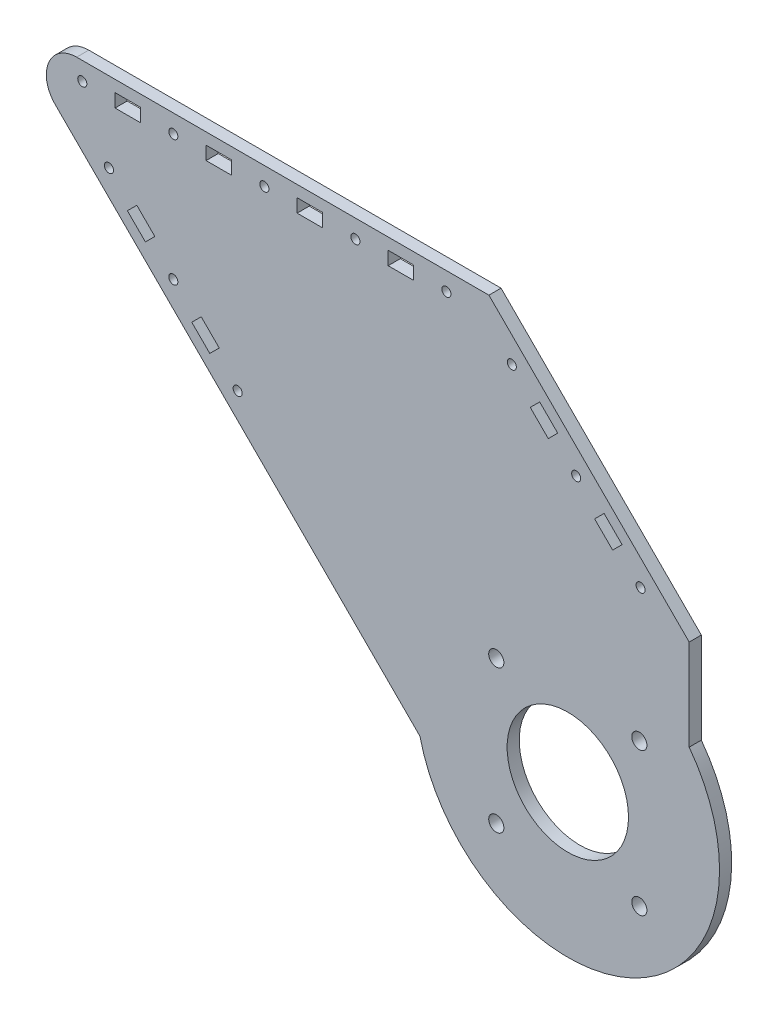
from build123d import *

# Parameters (mm, degrees)
SKETCH_1_R      = 1.5
SKETCH_1_R_2    = 20
SKETCH_1_R_3    = 2.5
SKETCH_1_W      = 8.4
SKETCH_1_H      = 4.4
EXTRUDE_1_DEPTH = 4


with BuildPart() as part:
    # 草图1 → 凸台-拉伸1 (new body)
    with BuildSketch(Plane.XY):
        with BuildLine():
            Line((-114.825580091, 141.054738201), (21.027428163, 141.054738201))
            Line((21.027428163, 141.054738201), (87.027428163, 75.054738201))
            Line((87.027428163, 75.054738201), (87.027428163, 45.054738201))
            ThreePointArc((87.027428163, 45.054738201), (68.103796299, -30.286045936), (-1.692603828, 3.813809292))
            Line((-1.692603828, 3.813809292), (-121.895642268, 123.982664897))
            ThreePointArc((-121.895642268, 123.982664897), (-124.064647496, 134.880915599), (-114.825580091, 141.054738201))
        make_face()
        with Locations((-52.972571837, 135.054738201)):
            Circle(SKETCH_1_R, mode=Mode.SUBTRACT)
        with Locations((47.027428163, 15.054738201)):
            Circle(SKETCH_1_R_2, mode=Mode.SUBTRACT)
        with Locations((-22.972571837, 135.054738201)):
            Circle(SKETCH_1_R, mode=Mode.SUBTRACT)
        with Locations((7.027428163, 135.054738201)):
            Circle(SKETCH_1_R, mode=Mode.SUBTRACT)
        with Locations((-112.972571837, 135.054738201)):
            Circle(SKETCH_1_R, mode=Mode.SUBTRACT)
        with Locations((-82.972571837, 135.054738201)):
            Circle(SKETCH_1_R, mode=Mode.SUBTRACT)
        with Locations((49.784787476, 103.812097514)):
            Circle(SKETCH_1_R, mode=Mode.SUBTRACT)
        with Locations((70.997990912, 82.598894078)):
            Circle(SKETCH_1_R, mode=Mode.SUBTRACT)
        with Locations((28.571584041, 125.025300949)):
            Circle(SKETCH_1_R, mode=Mode.SUBTRACT)
        with Locations((70.597428163, 38.624738201)):
            Circle(SKETCH_1_R_3, mode=Mode.SUBTRACT)
        with Locations((70.597428163, -8.515261799)):
            Circle(SKETCH_1_R_3, mode=Mode.SUBTRACT)
        with Locations((23.457428163, -8.515261799)):
            Circle(SKETCH_1_R_3, mode=Mode.SUBTRACT)
        with Locations((23.457428163, 38.624738201)):
            Circle(SKETCH_1_R_3, mode=Mode.SUBTRACT)
        with Locations((-82.972571837, 93.554738201)):
            Circle(SKETCH_1_R, mode=Mode.SUBTRACT)
        with Locations((-61.756351926, 72.34455167)):
            Circle(SKETCH_1_R, mode=Mode.SUBTRACT)
        with Locations((-104.188791747, 114.764924732)):
            Circle(SKETCH_1_R, mode=Mode.SUBTRACT)
        with Locations((-37.972571837, 135.054738201)):
            Rectangle(SKETCH_1_W, SKETCH_1_H, mode=Mode.SUBTRACT)
        with Locations((-7.972571837, 135.054738201)):
            Rectangle(SKETCH_1_W, SKETCH_1_H, mode=Mode.SUBTRACT)
        with Locations((-97.972571837, 135.054738201)):
            Rectangle(SKETCH_1_W, SKETCH_1_H, mode=Mode.SUBTRACT)
        with Locations((-67.972571837, 135.054738201)):
            Rectangle(SKETCH_1_W, SKETCH_1_H, mode=Mode.SUBTRACT)
        Polygon((55.865905794, 94.619709358), (61.805602756, 88.680012396), (64.916872594, 91.791282234), (58.977175632, 97.730979196), align=None, mode=Mode.SUBTRACT)
        Polygon((34.652702359, 115.832912794), (37.763972196, 118.944182631), (43.703669158, 113.004485669), (40.592399321, 109.893215832), align=None, mode=Mode.SUBTRACT)
        Polygon((-73.77931899, 87.474927176), (-76.890146348, 84.363214923), (-70.949604773, 78.424362694), (-67.838777415, 81.536074948), align=None, mode=Mode.SUBTRACT)
        Polygon((-89.054997326, 102.746261479), (-92.165824683, 99.634549225), (-98.106366259, 105.573401454), (-94.995538901, 108.685113708), align=None, mode=Mode.SUBTRACT)
    extrude(amount=EXTRUDE_1_DEPTH)


solid = part.part
